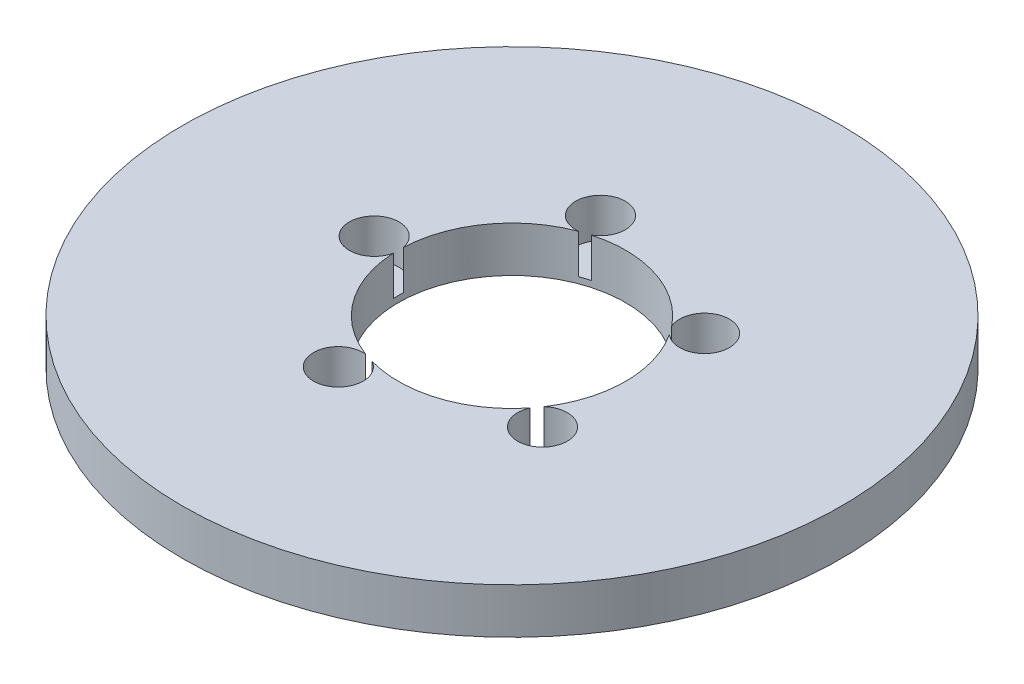
from build123d import *

# Parameters (mm, degrees)
SKETCH1_R           = 72.5
BOSS_EXTRUDE1_DEPTH = 10
SKETCH2_R           = 25
CUT_EXTRUDE1_DEPTH  = 104.01698889
SKETCH3_R           = 5.459028592
CUT_EXTRUDE2_DEPTH  = 8.645401834
CIRPATTERN1_COUNT   = 5


with BuildPart() as part:
    # Sketch1 → Boss-Extrude1 (new body)
    with BuildSketch(Plane(origin=(0, 0, 0), x_dir=(1, 0, 0), z_dir=(0, 1, 0))):
        Circle(SKETCH1_R)
    extrude(amount=BOSS_EXTRUDE1_DEPTH)

    # Sketch2 → Cut-Extrude1 (cut, through all)
    with BuildSketch(Plane(origin=(0, 0, 0), x_dir=(1, 0, 0), z_dir=(0, 1, 0))):
        Circle(SKETCH2_R)
    extrude(amount=CUT_EXTRUDE1_DEPTH, mode=Mode.SUBTRACT)

    # Sketch3 → Cut-Extrude2 (cut)
    with BuildSketch(Plane(origin=(0, 10, 0), x_dir=(1, 0, 0), z_dir=(0, 1, 0))):
        with Locations((-30.31913567, 0)):
            Circle(SKETCH3_R)
    cut_extrude2 = extrude(amount=-CUT_EXTRUDE2_DEPTH, mode=Mode.SUBTRACT)

    # CirPattern1: Cut-Extrude2 ×5 about axis
    cirpattern1_axis = Axis((0, 0, 0), (0, 1, 0))
    for i in range(1, CIRPATTERN1_COUNT):
        add(cut_extrude2.rotate(cirpattern1_axis, i * 360 / CIRPATTERN1_COUNT), mode=Mode.SUBTRACT)


solid = part.part
